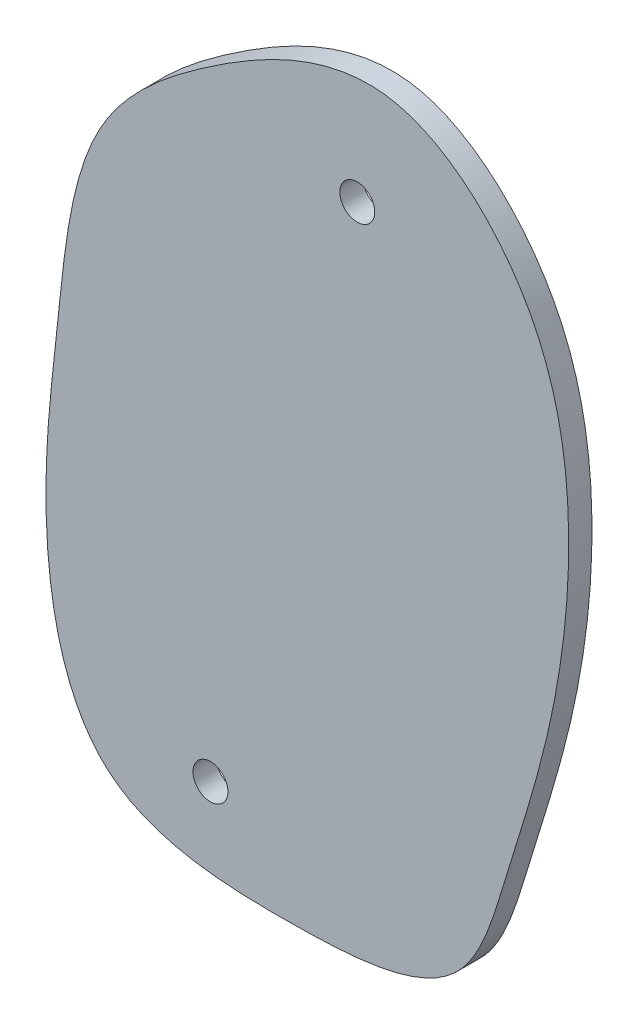
from build123d import *

# Parameters (mm, degrees)
SKETCH1_R           = 3.175
BOSS_EXTRUDE1_DEPTH = 4.292022727
SCALE1_OUTLINE_R    = 3.175
SCALE1_OUTLINE_R_2  = 2.348688635
SCALE1_DEPTH        = 4.292022727
SCALE1_START        = 3.733506643
SCALE1_2_OUTLINE_R  = 2.348688635
SCALE1_2_DEPTH      = 0.558516084
SCALE1_3_OUTLINE_R  = 2.348688635
SCALE1_3_DEPTH      = 0.558506643
SCALE1_START_2      = 0.558506643
SCALE1_4_DEPTH      = 3.175
SKETCH2_R           = 2.38125
CUT_EXTRUDE1_DEPTH  = 404.994279512


# Read off the part's stored shape, not the designer's step: Scale1
with BuildPart() as part:
    # Sketch1 → Boss-Extrude1 (new body)
    with BuildSketch(Plane.XY):
        with BuildLine():
            add(Edge.make_bspline(
                [(223.373184847, 188.492989992), (223.520701967, 197.832486561), (226.043026241, 217.413666195), (228.692941188, 250.146926935), (254.668089634, 271.734466889), (286.686049501, 288.632663861), (315.871283369, 261.795299485), (321.473675663, 227.704846902), (316.905035566, 194.844710387), (308.545734065, 169.286687144), (300.530505197, 141.890349058), (267.724984406, 139.548263597), (226.972726692, 141.690037178), (223.139486683, 173.697261791), (223.373184847, 188.492989992)],
                knots=[0, 0, 0, 0, 0.069390522, 0.163545185, 0.236408753, 0.328801364, 0.410139883, 0.498802464, 0.594040549, 0.664612452, 0.715775865, 0.797602763, 0.890070809, 1, 1, 1, 1], degree=3))
        make_face()
        with Locations((280.715181771, 261.522891733)):
            Circle(SKETCH1_R, mode=Mode.SUBTRACT)
        with Locations((253.667070014, 155.494293649)):
            Circle(SKETCH1_R, mode=Mode.SUBTRACT)
    extrude(amount=BOSS_EXTRUDE1_DEPTH)

    # Scale1 outline → Scale1 (cut)
    # profile 1 of 3: a face of its own
    with BuildSketch(Plane.XY):
        with BuildLine():
            add(Edge.make_bspline(
                [(223.373184847, 188.492989992), (223.139486683, 173.697261791), (226.972726692, 141.690037178), (267.724984406, 139.548263597), (300.530505197, 141.890349058), (308.545734065, 169.286687144), (316.905035566, 194.844710387), (321.473675663, 227.704846902), (315.871283369, 261.795299485), (286.686049501, 288.632663861), (254.668089634, 271.734466889), (228.692941188, 250.146926935), (226.043026241, 217.413666195), (223.520701967, 197.832486561), (223.373184847, 188.492989992)],
                knots=[0, 0, 0, 0, 0.109929191, 0.202397237, 0.284224135, 0.335387548, 0.405959451, 0.501197536, 0.589860117, 0.671198636, 0.763591247, 0.836454815, 0.930609478, 1, 1, 1, 1], degree=3))
        make_face()
        with Locations((253.667070014, 155.494293649)):
            Circle(SCALE1_OUTLINE_R, mode=Mode.SUBTRACT)
        with BuildLine():
            add(Edge.make_bspline(
                [(235.900042341, 193.696372127), (235.727165421, 182.751314279), (238.56278345, 159.07414745), (268.709039997, 157.489782326), (292.976741995, 159.222327052), (298.905963081, 179.488616154), (305.089709987, 198.39502205), (308.469336152, 222.703125726), (304.368415634, 247.657150571), (290.791642139, 260.362318248), (283.858282637, 261.971825965)],
                knots=[0, 0, 0, 0, 0.109929191, 0.202397237, 0.284224135, 0.335387548, 0.405959451, 0.501197536, 0.589860117, 0.668419862, 0.668419862, 0.668419862, 0.668419862], degree=3))
            add(Edge.make_bspline(
                [(277.63463032, 262.291544943), (271.075587485, 261.56432182), (257.545606428, 254.023286685), (239.83530258, 239.30452992), (237.875042699, 215.090281895), (236.009167312, 200.605212898), (235.900042341, 193.696372127)],
                knots=[0.691512339, 0.691512339, 0.691512339, 0.691512339, 0.763591247, 0.836454815, 0.930609478, 1, 1, 1, 1], degree=3))
            ThreePointArc((277.63463032, 262.291544943), (280.878071806, 264.693710529), (283.858282637, 261.971825965))
        make_face(mode=Mode.SUBTRACT)
    # profile 2 of 3: a face of its own
    with BuildSketch(Plane.XY):
        with Locations((258.30977582, 169.285769588)):
            Circle(SCALE1_OUTLINE_R_2)
    # profile 3 of 3: a face of its own
    with BuildSketch(Plane.XY):
        with Locations((278.318466427, 247.719836765)):
            Circle(SCALE1_OUTLINE_R_2)
    extrude(amount=SCALE1_DEPTH, mode=Mode.SUBTRACT)

    # Scale1 2 outline → Scale1 2 (cut)
    with BuildSketch(Plane.XY.offset(SCALE1_START)):
        with BuildLine():
            add(Edge.make_bspline(
                [(277.63463032, 262.291544943), (271.075587485, 261.56432182), (257.545606428, 254.023286685), (239.83530258, 239.30452992), (237.875042699, 215.090281895), (234.754992989, 190.868870524), (238.56278345, 159.07414745), (268.709039997, 157.489782326), (292.976741995, 159.222327052), (298.905963081, 179.488616154), (305.089709987, 198.39502205), (308.469336152, 222.703125726), (304.368415634, 247.657150571), (290.791642139, 260.362318248), (283.858282637, 261.971825965)],
                knots=[0.691512339, 0.691512339, 0.691512339, 0.691512339, 0.763591247, 0.836454815, 0.930609478, 1, 1.109929191, 1.202397237, 1.284224135, 1.335387548, 1.405959451, 1.501197536, 1.589860117, 1.668419862, 1.668419862, 1.668419862, 1.668419862], degree=3))
            ThreePointArc((283.858282637, 261.971825965), (280.552291736, 258.352072937), (277.63463032, 262.291544943))
        make_face()
        with Locations((258.30977582, 169.285769588)):
            Circle(SCALE1_2_OUTLINE_R, mode=Mode.SUBTRACT)
        with Locations((278.318466427, 247.719836765)):
            Circle(SCALE1_2_OUTLINE_R, mode=Mode.SUBTRACT)
    extrude(amount=SCALE1_2_DEPTH, mode=Mode.SUBTRACT)

    # Scale1 3 outline → Scale1 3 (cut)
    with BuildSketch(Plane.XY):
        with BuildLine():
            add(Edge.make_bspline(
                [(277.63463032, 262.291544943), (271.075587485, 261.56432182), (257.545606428, 254.023286685), (239.83530258, 239.30452992), (237.875042699, 215.090281895), (234.754992989, 190.868870524), (238.56278345, 159.07414745), (268.709039997, 157.489782326), (292.976741995, 159.222327052), (298.905963081, 179.488616154), (305.089709987, 198.39502205), (308.469336152, 222.703125726), (304.368415634, 247.657150571), (290.791642139, 260.362318248), (283.858282637, 261.971825965)],
                knots=[0.691512339, 0.691512339, 0.691512339, 0.691512339, 0.763591247, 0.836454815, 0.930609478, 1, 1.109929191, 1.202397237, 1.284224135, 1.335387548, 1.405959451, 1.501197536, 1.589860117, 1.668419862, 1.668419862, 1.668419862, 1.668419862], degree=3))
            ThreePointArc((283.858282637, 261.971825965), (280.552291736, 258.352072937), (277.63463032, 262.291544943))
        make_face()
        with Locations((258.30977582, 169.285769588)):
            Circle(SCALE1_3_OUTLINE_R, mode=Mode.SUBTRACT)
        with Locations((278.318466427, 247.719836765)):
            Circle(SCALE1_3_OUTLINE_R, mode=Mode.SUBTRACT)
    extrude(amount=SCALE1_3_DEPTH, mode=Mode.SUBTRACT)

    # Scale1 4 outline → Scale1 4 (add)
    with BuildSketch(Plane.XY.offset(SCALE1_START_2)):
        with BuildLine():
            ThreePointArc((277.63463032, 262.291544943), (280.552291736, 258.352072937), (283.858282637, 261.971825965))
            add(Edge.make_bspline(
                [(283.858282637, 261.971825965), (283.61303948, 262.028756628), (281.569221098, 262.456543056), (279.483138374, 262.496495243), (277.63463032, 262.291544943)],
                knots=[0.668419862, 0.668419862, 0.668419862, 0.668419862, 0.671198636, 0.691512339, 0.691512339, 0.691512339, 0.691512339], degree=3))
        make_face()
    extrude(amount=SCALE1_4_DEPTH)

    # Sketch2 → Cut-Extrude1 (cut, through all)
    with BuildSketch(Plane.XY.offset(3.733506643)):
        with Locations((278.318466427, 247.719836765)):
            Circle(SKETCH2_R)
        with Locations((258.30977582, 169.285769588)):
            Circle(SKETCH2_R)
    extrude(amount=-CUT_EXTRUDE1_DEPTH, mode=Mode.SUBTRACT)


solid = part.part
